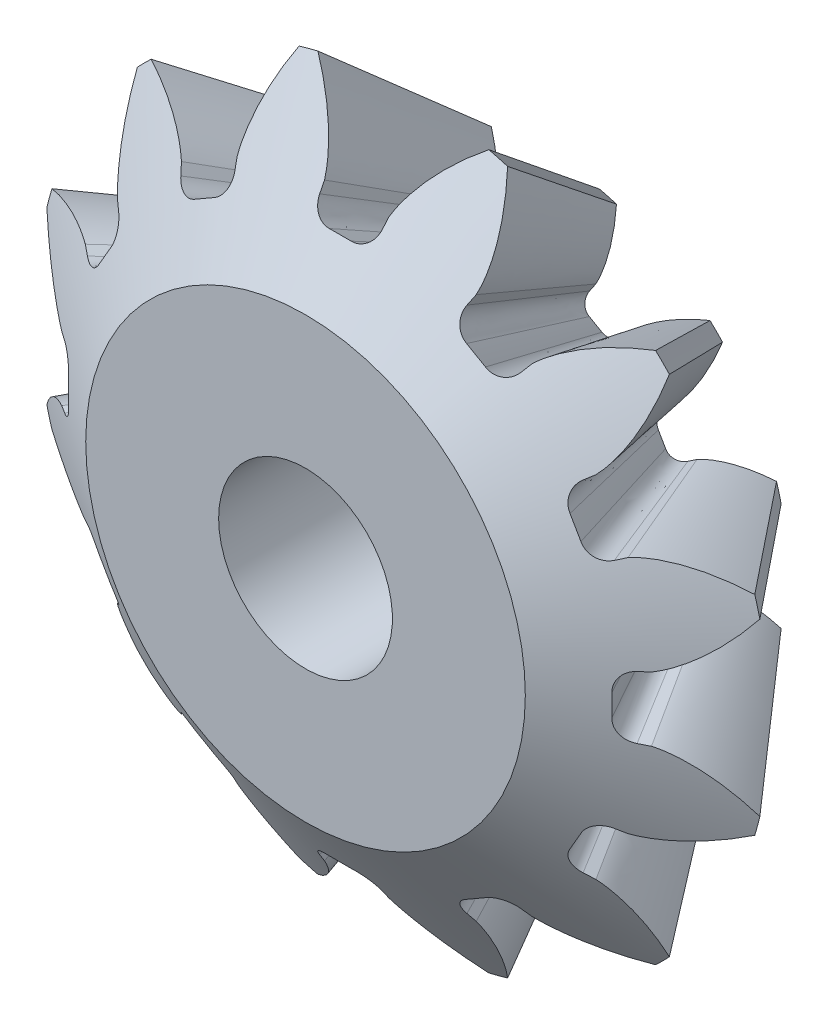
from build123d import *

# Parameters (mm, degrees)
TEETH_COUNT = 12


with BuildPart() as part:
    # Blank Sketch → Blank (revolve)
    with BuildSketch(Plane(origin=(0, 0, 0), x_dir=(1, 0, 0), z_dir=(0, 1, 0))):
        Polygon((6.213635009, -17.540922834), (11.620027042, -13.936661479), (17.611713424, -20.758857717), (10.560398314, -25.459734457), (4.175, -25.459734457), (4.175, -17.540922834), align=None)
    revolve(axis=Axis((0, 0, 0), (0, 0, 1)))

    # Heel Section Sketch for Tooth Space → Tooth Space section 0
    with BuildSketch(Plane(origin=(16.386750491, 0, 24.580125736), x_dir=(0.8320502943378437, 0, -0.5547001962252293), z_dir=(0.5547001962252291, 0, 0.8320502943378436))):
        with BuildLine():
            Line((-1.066374784, 1.68988369), (-1.612683016, 1.640324158))
            # circular arc as an exact rational Bezier (weights 1, cos(half-angle), 1)
            Bezier((-1.612683016, 1.640324158), (-2.5888721, 1.551767053), (-2.556169022, 0.572115076), weights=[1, 0.72700363, 1])
            Bezier((-2.556169022, 0.572115076), (-2.53707048, 0), (-2.556169022, -0.572115076), weights=[1, 0.999443275, 1])
            Bezier((-2.556169022, -0.572115076), (-2.5888721, -1.551767053), (-1.612683016, -1.640324158), weights=[1, 0.72700363, 1])
            Line((-1.612683016, -1.640324158), (-1.066374784, -1.68988369))
            add(Edge.make_bspline(
                [(-1.066374784, -1.68988369), (-1.035372525, -1.697340537), (-0.966838446, -1.715321869), (-0.822807653, -1.756377795), (-0.658148647, -1.814193489), (-0.438852943, -1.8979094), (-0.220734878, -1.99513781), (0.023356046, -2.113649813), (0.25633874, -2.239536468), (0.48862865, -2.374238883), (0.714381359, -2.515790282), (0.956018485, -2.676865081), (1.246312211, -2.884353615), (1.581517134, -3.143262351), (1.956340914, -3.460581855), (2.347932177, -3.822880907), (2.724933518, -4.20382349), (3.084418379, -4.595761205), (3.432015141, -5.007228077), (3.759014058, -5.420776027), (4.080816387, -5.86282633), (4.334380674, -6.230991233), (4.566411656, -6.595163152), (4.751112724, -6.891105409), (4.921642371, -7.185280843), (5.008184464, -7.337455298), (5.066028706, -7.44189404)],
                knots=[0.016753246, 0.016753246, 0.016753246, 0.016753246, 0.016753246, 0.031570807, 0.050064154, 0.068907149, 0.096646347, 0.124385911, 0.152125765, 0.179865217, 0.207604696, 0.235344406, 0.263083989, 0.300343415, 0.355822558, 0.411301707, 0.466780802, 0.522259921, 0.577739134, 0.63321816, 0.688697367, 0.744176442, 0.799655597, 0.827395173, 0.855134749, 0.910613937, 0.910613937, 0.910613937, 0.910613937, 0.910613937], degree=4))
            Line((5.066028706, -7.44189404), (5.066028706, 7.44189404))
            add(Edge.make_bspline(
                [(-1.066374784, 1.68988369), (-1.035372525, 1.697340537), (-0.966838446, 1.715321869), (-0.822807653, 1.756377795), (-0.658148647, 1.814193489), (-0.438852943, 1.8979094), (-0.220734878, 1.99513781), (0.023356046, 2.113649813), (0.25633874, 2.239536468), (0.48862865, 2.374238883), (0.714381359, 2.515790282), (0.956018485, 2.676865081), (1.246312211, 2.884353615), (1.581517134, 3.143262351), (1.956340914, 3.460581855), (2.347932177, 3.822880907), (2.724933518, 4.20382349), (3.084418379, 4.595761205), (3.432015141, 5.007228077), (3.759014058, 5.420776027), (4.080816387, 5.86282633), (4.334380674, 6.230991233), (4.566411656, 6.595163152), (4.751112724, 6.891105409), (4.921642371, 7.185280843), (5.008184464, 7.337455298), (5.066028706, 7.44189404)],
                knots=[0.016753246, 0.016753246, 0.016753246, 0.016753246, 0.016753246, 0.031570807, 0.050064154, 0.068907149, 0.096646347, 0.124385911, 0.152125765, 0.179865217, 0.207604696, 0.235344406, 0.263083989, 0.300343415, 0.355822558, 0.411301707, 0.466780802, 0.522259921, 0.577739134, 0.63321816, 0.688697367, 0.744176442, 0.799655597, 0.827395173, 0.855134749, 0.910613937, 0.910613937, 0.910613937, 0.910613937, 0.910613937], degree=4))
        make_face()
    # Toe Section Sketch for Tooth Space → Tooth Space section 1
    with BuildSketch(Plane(origin=(8.620947743, 0, 12.931421615), x_dir=(0.8320502943378437, 0, -0.5547001962252291), z_dir=(0.5547001962252291, 0, 0.8320502943378437))):
        with BuildLine():
            Line((-0.561011855, 0.88903526), (-0.848420559, 0.862962358))
            Bezier((-0.848420559, 0.862962358), (-1.361986387, 0.816373123), (-1.34478154, 0.300985493), weights=[1, 0.72700363, 1])
            Bezier((-1.34478154, 0.300985493), (-1.334733939, 0), (-1.34478154, -0.300985493), weights=[1, 0.999443275, 1])
            Bezier((-1.34478154, -0.300985493), (-1.361986387, -0.816373123), (-0.848420559, -0.862962358), weights=[1, 0.72700363, 1])
            Line((-0.848420559, -0.862962358), (-0.561011855, -0.88903526))
            add(Edge.make_bspline(
                [(-0.561011855, -0.88903526), (-0.544701797, -0.892958252), (-0.508646488, -0.902418167), (-0.432872109, -0.924018916), (-0.346249069, -0.954430195), (-0.230873417, -0.998483006), (-0.116133563, -1.049615299), (0.012297567, -1.111993751), (0.134841678, -1.178174201), (0.257090097, -1.249116739), (0.375789542, -1.323464219), (0.503021355, -1.408400048), (0.655548801, -1.517208073), (0.832263819, -1.654079238), (1.028834407, -1.819896644), (1.235799822, -2.012218694), (1.432663744, -2.20996889), (1.62415624, -2.420443983), (1.803152215, -2.629922226), (1.981565467, -2.85900919), (2.140218807, -3.072349023), (2.310974068, -3.326750089), (2.441505074, -3.527106448), (2.574451346, -3.75413792), (2.634768655, -3.860180744), (2.665200081, -3.91512519)],
                knots=[0.016753246, 0.016753246, 0.016753246, 0.016753246, 0.016753246, 0.031570807, 0.050064154, 0.068907149, 0.096646347, 0.124385911, 0.152125765, 0.179865217, 0.207604696, 0.235344406, 0.263083989, 0.300343415, 0.355822558, 0.411301707, 0.466780802, 0.522259921, 0.577739134, 0.63321816, 0.688697367, 0.744176442, 0.799655597, 0.855134749, 0.910613937, 0.910613937, 0.910613937, 0.910613937, 0.910613937], degree=4))
            Line((2.665200081, -3.91512519), (2.665200081, 3.91512519))
            add(Edge.make_bspline(
                [(-0.561011855, 0.88903526), (-0.544701797, 0.892958252), (-0.508646488, 0.902418167), (-0.432872109, 0.924018916), (-0.346249069, 0.954430195), (-0.230873417, 0.998483006), (-0.116133563, 1.049615299), (0.012297567, 1.111993751), (0.134841678, 1.178174201), (0.257090097, 1.249116739), (0.375789542, 1.323464219), (0.503021355, 1.408400048), (0.655548801, 1.517208073), (0.832263819, 1.654079238), (1.028834407, 1.819896644), (1.235799822, 2.012218694), (1.432663744, 2.20996889), (1.62415624, 2.420443983), (1.803152215, 2.629922226), (1.981565467, 2.85900919), (2.140218807, 3.072349023), (2.310974068, 3.326750089), (2.441505074, 3.527106448), (2.574451346, 3.75413792), (2.634768655, 3.860180744), (2.665200081, 3.91512519)],
                knots=[0.016753246, 0.016753246, 0.016753246, 0.016753246, 0.016753246, 0.031570807, 0.050064154, 0.068907149, 0.096646347, 0.124385911, 0.152125765, 0.179865217, 0.207604696, 0.235344406, 0.263083989, 0.300343415, 0.355822558, 0.411301707, 0.466780802, 0.522259921, 0.577739134, 0.63321816, 0.688697367, 0.744176442, 0.799655597, 0.855134749, 0.910613937, 0.910613937, 0.910613937, 0.910613937, 0.910613937], degree=4))
        make_face()
    tooth_space = loft(mode=Mode.SUBTRACT)

    # Teeth: Tooth Space ×12 about axis
    teeth_axis = Axis((0, 0, -1.352081728), (0, 0, 1))
    for i in range(1, TEETH_COUNT):
        add(tooth_space.rotate(teeth_axis, i * 360 / TEETH_COUNT), mode=Mode.SUBTRACT)


solid = part.part
